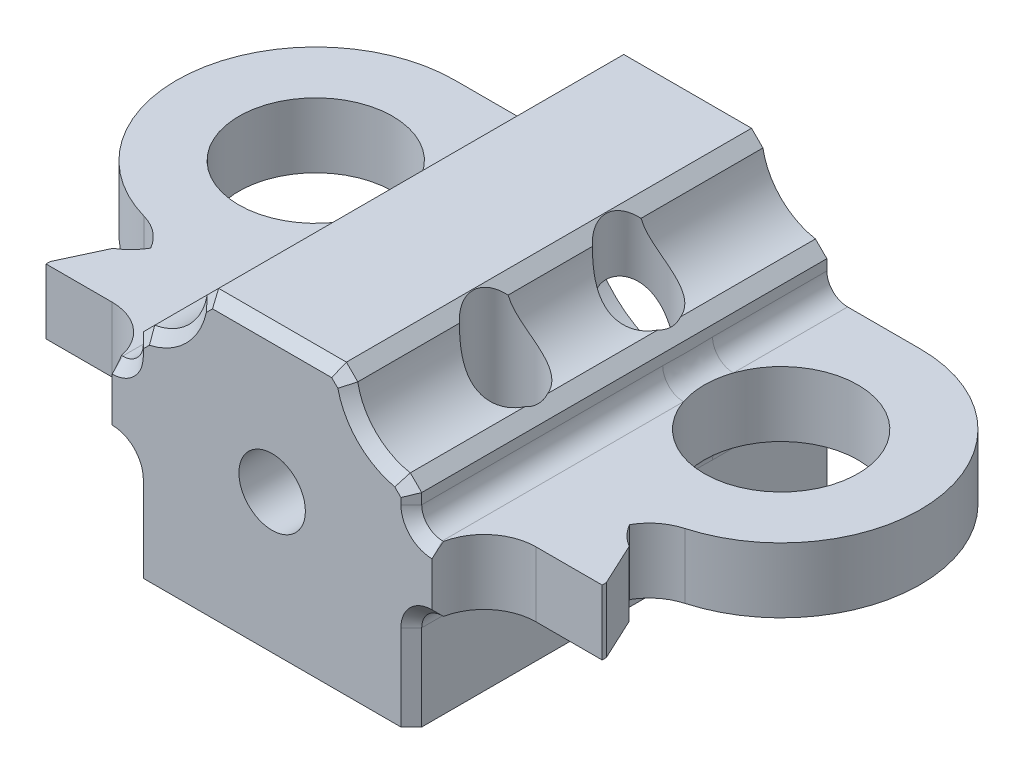
from build123d import *

# Parameters (mm, degrees)
SKETCH1_W           = 17.018
SKETCH1_H           = 17.018
BOSS_EXTRUDE1_DEPTH = 25.4
SKETCH4_R           = 1.075
CUT_EXTRUDE2_DEPTH  = 32.736026925
SKETCH5_R           = 4.699
BOSS_EXTRUDE2_DEPTH = 1.984375
FILLET2_R           = 3.175
SKETCH7_R           = 3.96875
CUT_EXTRUDE3_DEPTH  = 39.099365106
FILLET3_R           = 1.27
CHAMFER1_SIZE       = 0.635
CHAMFER2_SIZE       = 0.635
CUT_EXTRUDE4_DEPTH  = 39.099365039
SKETCH10_R          = 2
CUT_EXTRUDE6_DEPTH  = 13.97


with BuildPart() as part:
    # Sketch1 → Boss-Extrude1 (new body)
    with BuildSketch(Plane.XY):
        with Locations((0, 8.509)):
            Rectangle(SKETCH1_W, SKETCH1_H)
    extrude(amount=BOSS_EXTRUDE1_DEPTH)

    # Sketch2 → Cut-Revolve1 (revolve, cut)
    with BuildSketch(Plane(origin=(0, 0, 0), x_dir=(0, 0, -1), z_dir=(1, 0, 0)), mode=Mode.PRIVATE) as cut_revolve1_sk:
        Polygon((1.07979009, 8.509), (1.07979009, 14.859), (-13.97, 14.859), (-13.97, 10.541), (-27.616970176, 10.541), (-27.616970176, 8.509), align=None)
    revolve(cut_revolve1_sk.sketch.rotate(Axis((0, 8.509, 27.616970176), (0, 0, -1)), 90), axis=Axis((0, 8.509, 27.616970176), (0, 0, -1)), mode=Mode.SUBTRACT)

    # Sketch4 → Cut-Extrude2 (cut, through all)
    with BuildSketch(Plane.XZ):
        with Locations(Location((-5.999999938, 17.066338716, 0), (0, 0, 270))):
            Circle(SKETCH4_R)
        with Locations(Location((5.938000062, 17.066338716, 0), (0, 0, 270))):
            Circle(SKETCH4_R)
        with Locations(Location((5.938000062, 8.938338716, 0), (0, 0, 270))):
            Circle(SKETCH4_R)
        with Locations(Location((-5.999999938, 8.938338716, 0), (0, 0, 270))):
            Circle(SKETCH4_R)
    extrude(amount=-CUT_EXTRUDE2_DEPTH, mode=Mode.SUBTRACT)

    # Sketch5 → Boss-Extrude2 (add, symmetric)
    with BuildSketch(Plane(origin=(0, 8.509, 0), x_dir=(1, 0, 0), z_dir=(0, 1, 0))):
        with BuildLine():
            Line((8.509, 0), (14.224, 0))
            ThreePointArc((14.224, 0), (22.733, -8.509), (14.224, -17.018))
            Line((14.224, -17.018), (14.224, -19.350060272))
            Line((14.224, -19.350060272), (15.776044535, -19.350060272))
            Line((15.776044535, -19.350060272), (16.997431214, -21.969332458))
            Line((16.997431214, -21.969332458), (16.997431214, -25.4))
            Line((16.997431214, -25.4), (8.509, -25.4))
            Line((8.509, -25.4), (8.509, 0))
        make_face()
        with Locations(Location((14.224, -8.509, 0), (0, 0, 270))):
            Circle(SKETCH5_R, mode=Mode.SUBTRACT)
    boss_extrude2 = extrude(amount=BOSS_EXTRUDE2_DEPTH, both=True)

    # Mirror1: Boss-Extrude2 across plane
    add(boss_extrude2.mirror(Plane(origin=(0, 0, 0), x_dir=(0, 0, 1), z_dir=(1, 0, 0))))

    # Fillet2
    # the kernel refuses this fillet: 3.175 mm, written as the material it adds along each edge
    with BuildSketch(Plane(origin=(14.224, 10.493375, 17.018), x_dir=(0.9905480679364438, 0, -0.1371660493977233), z_dir=(0, -1, 0))) as fillet2_piece_1:
        with BuildLine():
            CenterArc((2.769794035, 3.144990116), FILLET2_R, 187.883890744, 74.232218513)
            Line((-0.37519608, 2.709487909), (0, 0))
            ThreePointArc((0, 0), (1.167145914, 0.08042649), (2.334291829, 0))
        make_face()
    extrude(amount=3.96875)
    with BuildSketch(Plane(origin=(14.224, 10.493375, 19.350060272), x_dir=(0, 0, -1), z_dir=(0, -1, 0))) as fillet2_piece_2:
        with BuildLine():
            CenterArc((2.728853341, 3.175), FILLET2_R, 210.74159938, 59.25840062)
            Line((0, 1.552044535), (0, 0))
            Line((0, 0), (2.728853341, 0))
        make_face()
    extrude(amount=3.96875)
    with BuildSketch(Plane(origin=(-14.224, 10.493375, 19.350060272), x_dir=(0, 0, -1), z_dir=(0, -1, 0))) as fillet2_piece_3:
        with BuildLine():
            CenterArc((2.728853341, -3.175), FILLET2_R, 90, 59.25840062)
            Line((0, -1.552044535), (0, 0))
            Line((0, 0), (2.728853341, 0))
        make_face()
    extrude(amount=3.96875)
    with BuildSketch(Plane(origin=(-14.224, 10.493375, 17.018), x_dir=(-0.9905480679364438, 0, -0.1371660493977233), z_dir=(0, -1, 0))) as fillet2_piece_4:
        with BuildLine():
            CenterArc((2.769794035, -3.144990116), FILLET2_R, 97.883890744, 74.232218513)
            Line((-0.37519608, -2.709487909), (0, 0))
            ThreePointArc((0, 0), (1.167145914, -0.08042649), (2.334291829, 0))
        make_face()
    extrude(amount=3.96875)

    # Sketch7 → Cut-Extrude3 (cut, through all)
    with BuildSketch(Plane.XY.offset(25.4)):
        with Locations((8.509, 17.018)):
            Circle(SKETCH7_R)
        with Locations((-8.509, 17.018)):
            Circle(SKETCH7_R)
    extrude(amount=-CUT_EXTRUDE3_DEPTH, mode=Mode.SUBTRACT)

    # Fillet3
    fillet3_edges = [part.edges().sort_by_distance(p)[0] for p in [
        (-8.509, 6.524625, 12.7),
        (8.509, 6.524625, 12.7),
        (-8.509, 10.493375, 12.7),
        (8.509, 10.493375, 12.7),
    ]]
    fillet(fillet3_edges, radius=FILLET3_R)

    # Chamfer1
    # the kernel refuses this chamfer: 0.635 mm, written as the material it takes off along each edge
    with BuildSketch(Plane(origin=(8.509, 13.04925, -1.79748153), x_dir=(0, -1, 0), z_dir=(0, 0, 1))) as chamfer1_piece_1:
        with BuildLine():
            Line((CHAMFER1_SIZE, 0), (-0.061614969, -0.696614969))
            ThreePointArc((-0.061614969, -0.696614969), (-0.016308757, -0.359422847), (0, 0))
            Line((0, 0), (CHAMFER1_SIZE, 0))
        make_face()
    extrude(amount=28.994963061, mode=Mode.SUBTRACT)
    with BuildSketch(Plane(origin=(4.54025, 17.018, -1.79748153), x_dir=(0.08810514081728205, -0.9961111806227089, 0), z_dir=(0, 0, 1)), Plane(origin=(-8.509, 13.04925, -1.79748153), x_dir=(0.9961111806227088, 0.08810514081728424, 0), z_dir=(0, 0, 1))) as chamfer1_piece_2:
        with BuildLine():
            Line((0.699334555, 0), (-CHAMFER1_SIZE * 0.0881051408173, -CHAMFER1_SIZE * 0.996111180623))
            Line((-CHAMFER1_SIZE * 0.0881051408173, -CHAMFER1_SIZE * 0.996111180623), (0, 0))
            ThreePointArc((0, 0), (0.359462002, -0.015421665), (0.699334555, 0))
        make_face()
    extrude(amount=28.994963061, mode=Mode.SUBTRACT)
    with BuildSketch(Plane(origin=(-4.54025, 17.018, 27.19748153), x_dir=(1, 0, 0), z_dir=(0, 0, -1))) as chamfer1_piece_3:
        with BuildLine():
            Line((CHAMFER1_SIZE, 0), (-0.061614969, 0.696614969))
            ThreePointArc((-0.061614969, 0.696614969), (-0.016308757, 0.359422847), (0, 0))
            Line((0, 0), (CHAMFER1_SIZE, 0))
        make_face()
    extrude(amount=28.994963061, mode=Mode.SUBTRACT)

    # Chamfer2
    chamfer2_edges = [part.edges().sort_by_distance(p)[0] for p in [
        (8.509, 2.6273125, 25.4),
        (-13.388215607, 6.524625, 25.4),
        (-8.509, 2.6273125, 25.4),
        (13.388215607, 6.524625, 25.4),
        (-13.388215607, 10.493375, 25.4),
        (13.388215607, 10.493375, 25.4),
        (8.509, 12.0888125, 25.4),
        (-8.880974388, 6.152650612, 25.4),
        (8.880974388, 6.152650612, 25.4),
        (-8.880974388, 10.865349388, 25.4),
        (8.880974388, 10.865349388, 25.4),
        (-5.702669962, 14.211669962, 25.4),
        (-8.509, 12.0888125, 25.4),
        (5.702669962, 14.211669962, 25.4),
        (0, 17.018, 25.4),
        (-8.160692515, 12.762557485, 25.4),
        (-4.253557485, 16.669692515, 25.4),
        (4.253557485, 16.669692515, 25.4),
        (8.160692515, 12.762557485, 25.4),
        (16.997431214, 8.509, 25.4),
        (-16.997431214, 8.509, 25.4),
    ]]
    chamfer(chamfer2_edges, length=CHAMFER2_SIZE)

    # Sketch8 → Cut-Extrude4 (cut, through all)
    with BuildSketch(Plane(origin=(0, 17.018, 0), x_dir=(1, 0, 0), z_dir=(0, 1, 0))):
        with BuildLine():
            Line((-16.997431214, -22.225), (-12.954, -22.225))
            ThreePointArc((-12.954, -22.225), (-10.70893597, -23.15493597), (-9.779, -25.4))
            Line((-9.779, -25.4), (-16.997431214, -25.4))
            Line((-16.997431214, -25.4), (-16.997431214, -22.225))
        make_face()
        with BuildLine():
            Line((16.997431214, -25.4), (9.779, -25.4))
            ThreePointArc((9.779, -25.4), (10.70893597, -23.15493597), (12.954, -22.225))
            Line((12.954, -22.225), (16.997431214, -22.225))
            Line((16.997431214, -22.225), (16.997431214, -25.4))
        make_face()
    extrude(amount=-CUT_EXTRUDE4_DEPTH, mode=Mode.SUBTRACT)

    # Sketch10 → Cut-Extrude6 (cut)
    with BuildSketch(Plane(origin=(0, 17.018, 0), x_dir=(1, 0, 0), z_dir=(0, 1, 0))):
        with Locations(Location((5.938000062, -8.938338716, 0), (0, 0, 270))):
            Circle(SKETCH10_R)
        with Locations(Location((-5.999999938, -8.938338716, 0), (0, 0, 314.352235931))):
            Circle(SKETCH10_R)
        with Locations(Location((5.938000062, -17.066338716, 0), (0, 0, 228.081924597))):
            Circle(SKETCH10_R)
        with Locations(Location((-5.999999938, -17.066338716, 0), (0, 0, 270))):
            Circle(SKETCH10_R)
    extrude(amount=-CUT_EXTRUDE6_DEPTH, mode=Mode.SUBTRACT)


solid = part.part
